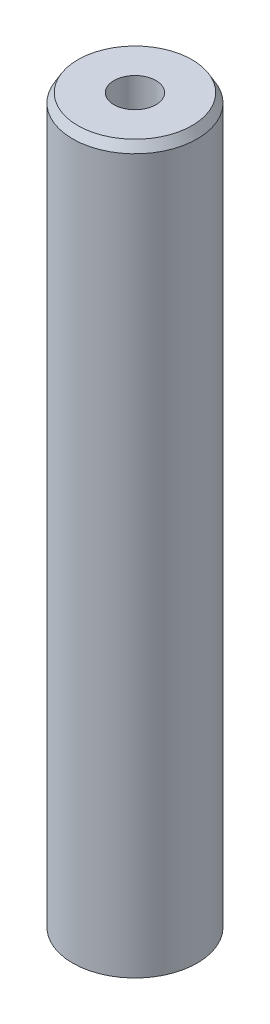
from build123d import *
from OCP.BRepFilletAPI import BRepFilletAPI_MakeChamfer

# Parameters (mm, degrees)
SKETCH1_R           = 10
BOSS_EXTRUDE1_DEPTH = 116.868068885
SKETCH2_R           = 3.371143882
CUT_EXTRUDE1_DEPTH  = 118.720624892
CHAMFER1_SIZE       = 1.438272716
CHAMFER1_SIZE2      = 0.83038714


with BuildPart() as part:
    # Sketch1 → Boss-Extrude1 (new body)
    with BuildSketch(Plane(origin=(0, 0, 0), x_dir=(1, 0, 0), z_dir=(0, 1, 0))):
        Circle(SKETCH1_R)
    extrude(amount=BOSS_EXTRUDE1_DEPTH)

    # Sketch2 → Cut-Extrude1 (cut, through all)
    with BuildSketch(Plane(origin=(0, 0, 0), x_dir=(1, 0, 0), z_dir=(0, 1, 0))):
        Circle(SKETCH2_R)
    extrude(amount=CUT_EXTRUDE1_DEPTH, mode=Mode.SUBTRACT)

    # Chamfer1: one chamfer whose edges measure the first distance from different faces: ONE call of the kernel's chamfer builder (chamfer() names one face for all edges)
    chamfer1_edges_1 = [part.edges().sort_by_distance(p)[0] for p in [
        (-10, 116.868068885, 0),
    ]]
    chamfer1_side_1 = [part.faces().sort_by_distance(p)[0] for p in [
        (-10, 58.434034443, 0),
    ]]
    chamfer1_edges_2 = [part.edges().sort_by_distance(p)[0] for p in [
        (-10, 0, 0),
    ]]
    chamfer1_side_2 = [part.faces().sort_by_distance(p)[0] for p in [
        (-9.717157288, 0, 0),
    ]]
    chamfer1 = BRepFilletAPI_MakeChamfer(part.part.solid().wrapped)
    for e in chamfer1_edges_1:
        chamfer1.Add(CHAMFER1_SIZE, CHAMFER1_SIZE2, e.wrapped, chamfer1_side_1[0].wrapped)  # the first distance lies on this face
    for e in chamfer1_edges_2:
        chamfer1.Add(CHAMFER1_SIZE, CHAMFER1_SIZE2, e.wrapped, chamfer1_side_2[0].wrapped)  # the first distance lies on this face
    add(Compound.cast(chamfer1.Shape()), mode=Mode.REPLACE)


solid = part.part
